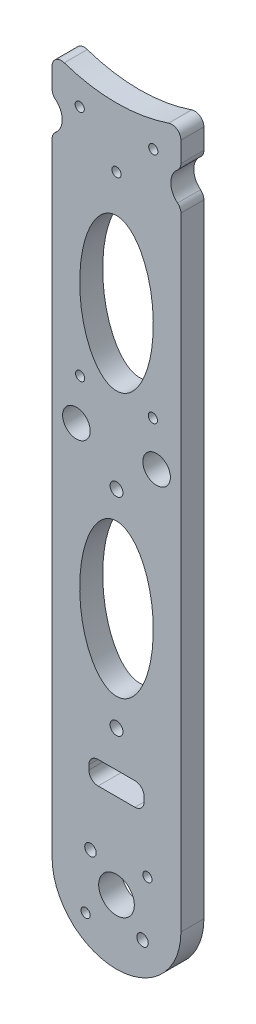
from build123d import *

# Parameters (mm, degrees)
SKETCH1_R           = 1
SKETCH1_R_2         = 1.25
SKETCH1_R_3         = 1.4
SKETCH1_R_4         = 3
SKETCH1_RX          = 16.5
SKETCH1_RY          = 8
BOSS_EXTRUDE1_DEPTH = 5
CUT_EXTRUDE1_REACH  = 153.803
SKETCH2_R           = 3.875


with BuildPart() as part:
    # Sketch1 → Boss-Extrude1 (new body)
    with BuildSketch(Plane.XY):
        with BuildLine():
            Line((-14, 0), (-14, 135.347392982))
            ThreePointArc((-14, 135.347392982), (-13.809166738, 136.199986504), (-13.273084285, 136.889876824))
            ThreePointArc((-13.273084285, 136.889876824), (-11.805402668, 140.00423401), (-13.273084285, 143.118591196))
            ThreePointArc((-13.273084285, 143.118591196), (-13.809166738, 143.808481515), (-14, 144.661075038))
            Line((-14, 144.661075038), (-14, 149.07320666))
            ThreePointArc((-14, 149.07320666), (-13.162476387, 150.700673602), (-11.351351351, 150.965098552))
            ThreePointArc((-11.351351351, 150.965098552), (0, 149.07320666), (11.351351351, 150.965098552))
            ThreePointArc((11.351351351, 150.965098552), (13.162476387, 150.700673602), (14, 149.07320666))
            Line((14, 149.07320666), (14, 144.661075038))
            ThreePointArc((14, 144.661075038), (13.809166738, 143.808481515), (13.273084285, 143.118591196))
            ThreePointArc((13.273084285, 143.118591196), (11.805402668, 140.00423401), (13.273084285, 136.889876824))
            ThreePointArc((13.273084285, 136.889876824), (13.809166738, 136.199986504), (14, 135.347392982))
            Line((14, 135.347392982), (14, 0))
            ThreePointArc((14, 0), (0, -14), (-14, 0))
        make_face()
        with Locations((-8, 144.371191598)):
            Circle(SKETCH1_R, mode=Mode.SUBTRACT)
        with Locations((5.656854249, -5.656854249)):
            Circle(SKETCH1_R_2, mode=Mode.SUBTRACT)
        with Locations((-6.717514421, -6.717514421)):
            Circle(SKETCH1_R, mode=Mode.SUBTRACT)
        with Locations((6.717514421, 6.717514421)):
            Circle(SKETCH1_R, mode=Mode.SUBTRACT)
        with Locations((-5.656854249, 5.656854249)):
            Circle(SKETCH1_R_2, mode=Mode.SUBTRACT)
        with Locations((8, 144.371191598)):
            Circle(SKETCH1_R, mode=Mode.SUBTRACT)
        with Locations((0, 136.07320666)):
            Circle(SKETCH1_R, mode=Mode.SUBTRACT)
        with Locations((7.903282752, 93.738271437)):
            Circle(SKETCH1_R, mode=Mode.SUBTRACT)
        with Locations((0, 31.383897204)):
            Circle(SKETCH1_R_3, mode=Mode.SUBTRACT)
        with Locations((0, 76.383897204)):
            Circle(SKETCH1_R_3, mode=Mode.SUBTRACT)
        with Locations((8.715574275, 84.453736851)):
            Circle(SKETCH1_R_4, mode=Mode.SUBTRACT)
        with Locations((-7.903282752, 93.738271437)):
            Circle(SKETCH1_R, mode=Mode.SUBTRACT)
        with Locations((-8.715574275, 84.453736851)):
            Circle(SKETCH1_R_4, mode=Mode.SUBTRACT)
        with Locations(Location((0, 53.883897204), (0, 0, 90))):
            Ellipse(SKETCH1_RX, SKETCH1_RY, mode=Mode.SUBTRACT)
        with Locations(Location((0, 111.383897204), (0, 0, 90))):
            Ellipse(SKETCH1_RX, SKETCH1_RY, mode=Mode.SUBTRACT)
        with BuildLine():
            Line((-4, 18.5), (4, 18.5))
            ThreePointArc((4, 18.5), (5.414213562, 19.085786438), (6, 20.5))
            Line((6, 20.5), (6, 21.5))
            ThreePointArc((6, 21.5), (5.414213562, 22.914213562), (4, 23.5))
            Line((4, 23.5), (-4, 23.5))
            ThreePointArc((-4, 23.5), (-5.414213562, 22.914213562), (-6, 21.5))
            Line((-6, 21.5), (-6, 20.5))
            ThreePointArc((-6, 20.5), (-5.414213562, 19.085786438), (-4, 18.5))
        make_face(mode=Mode.SUBTRACT)
    extrude(amount=BOSS_EXTRUDE1_DEPTH)

    # Sketch2 → Cut-Extrude1 (cut, up to next)
    with BuildSketch(Plane.XY.offset(5), mode=Mode.PRIVATE) as cut_extrude1_sk1:
        Circle(SKETCH2_R)
    cut_extrude1_tool1 = extrude(cut_extrude1_sk1.sketch, amount=-CUT_EXTRUDE1_REACH, mode=Mode.PRIVATE) & part.part
    add(cut_extrude1_tool1.solids().sort_by_distance((0, 0, 5))[0], mode=Mode.SUBTRACT)


solid = part.part
